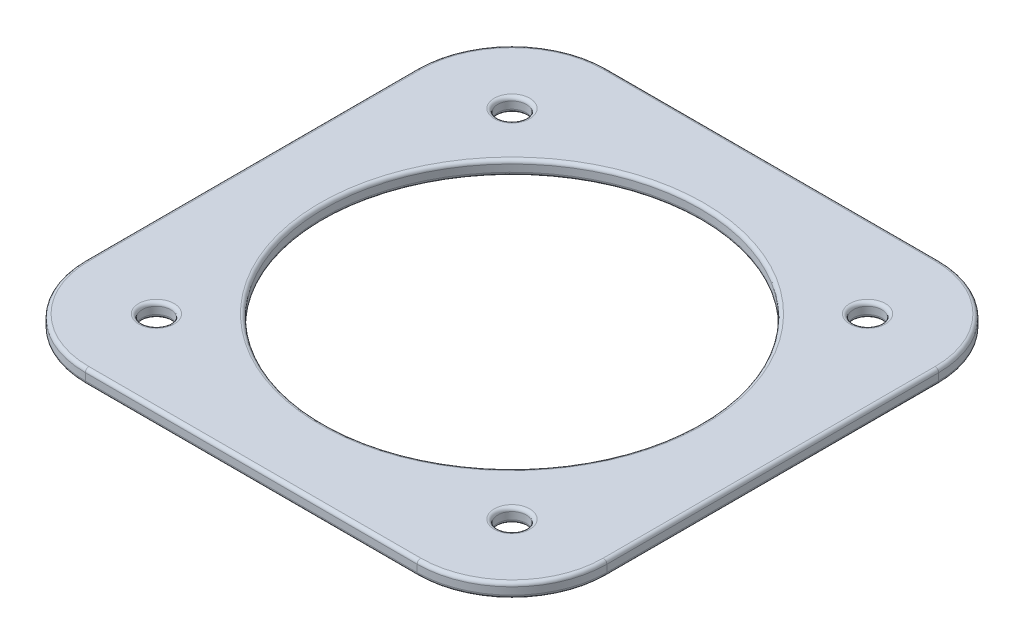
from build123d import *

# Parameters (mm, degrees)
SKETCH1_R                      = 79.5
BOSS_EXTRUDE1_DEPTH            = 6
CBORE_FOR_M10_SHCS_D           = 12
CBORE_FOR_M10_SHCS_CBORE_D     = 18
CBORE_FOR_M10_SHCS_CBORE_DEPTH = 10
FILLET1_R                      = 1.5


with BuildPart() as part:
    # Sketch1 → Boss-Extrude1 (new body)
    with BuildSketch(Plane(origin=(0, 0, 0), x_dir=(1, 0, 0), z_dir=(0, 1, 0))):
        with BuildLine():
            Line((-70, -110), (70, -110))
            ThreePointArc((70, -110), (98.284271247, -98.284271247), (110, -70))
            Line((110, -70), (110, 70))
            ThreePointArc((110, 70), (98.284271247, 98.284271247), (70, 110))
            Line((70, 110), (-70, 110))
            ThreePointArc((-70, 110), (-98.284271247, 98.284271247), (-110, 70))
            Line((-110, 70), (-110, -70))
            ThreePointArc((-110, -70), (-98.284271247, -98.284271247), (-70, -110))
        make_face()
        Circle(SKETCH1_R, mode=Mode.SUBTRACT)
    extrude(amount=BOSS_EXTRUDE1_DEPTH)

    # CBORE for M10 SHCS (through all)
    with Locations(Plane(origin=(0, 21, 0), x_dir=(1, 0, 0), z_dir=(0, 1, 0))):
        with Locations((0, 0), (-75, 75), (75, 75), (75, -75), (-75, -75), (0, 250), (-250, 0), (250, 0), (0, -250)):
            CounterBoreHole(CBORE_FOR_M10_SHCS_D / 2, CBORE_FOR_M10_SHCS_CBORE_D / 2, CBORE_FOR_M10_SHCS_CBORE_DEPTH)

    # Fillet1
    fillet1_edges = [part.edges().sort_by_distance(p)[0] for p in [
        (-79.5, 0, 0),
        (0, 0, 110),
        (98.284271247, 0, 98.284271247),
        (110, 0, 0),
        (98.284271247, 0, -98.284271247),
        (0, 0, -110),
        (-98.284271247, 0, -98.284271247),
        (-110, 0, 0),
        (-98.284271247, 0, 98.284271247),
        (-79.5, 6, 0),
        (-110, 6, 0),
        (-98.284271247, 6, -98.284271247),
        (0, 6, -110),
        (98.284271247, 6, -98.284271247),
        (110, 6, 0),
        (98.284271247, 6, 98.284271247),
        (0, 6, 110),
        (-98.284271247, 6, 98.284271247),
        (-69, 0, 75),
        (81, 0, 75),
        (81, 0, -75),
        (-69, 0, -75),
        (-69, 6, 75),
        (81, 6, 75),
        (81, 6, -75),
        (-69, 6, -75),
    ]]
    fillet(fillet1_edges, radius=FILLET1_R)


solid = part.part
